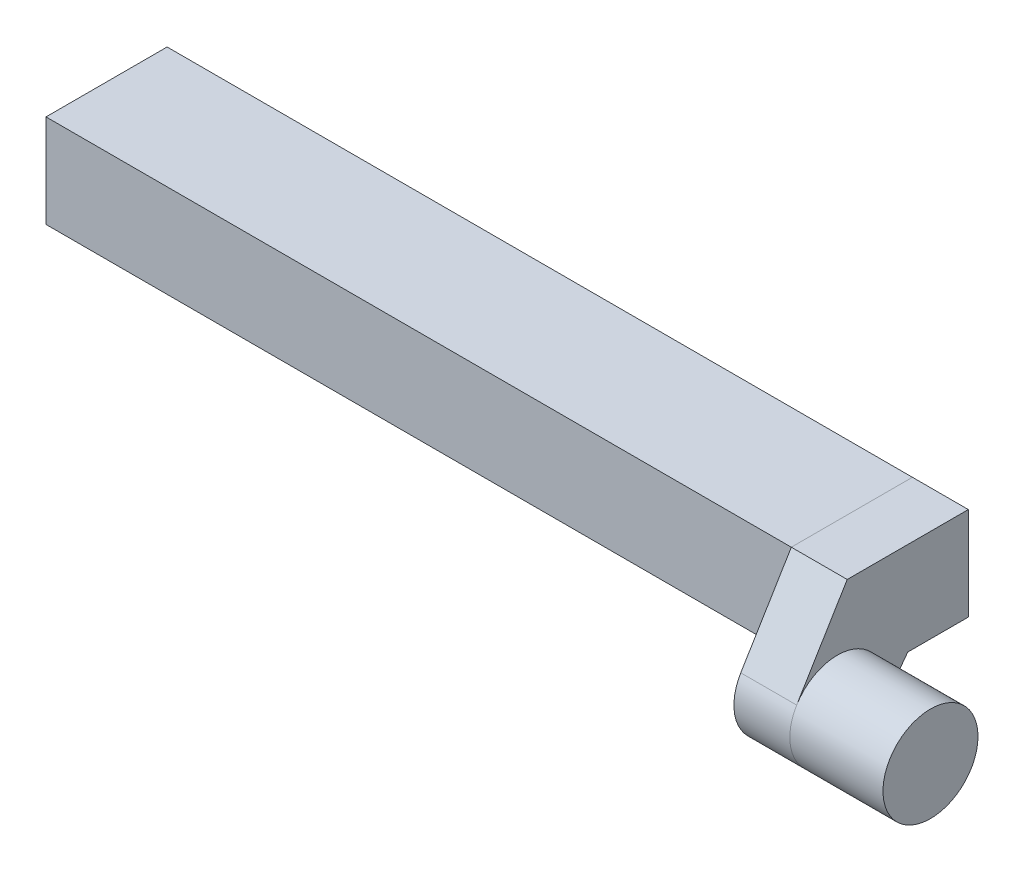
from build123d import *

# Parameters (mm, degrees)
SKETCH2_W           = 6.5
SKETCH2_H           = 5
SKETCH2_W_2         = 4.1
SKETCH2_H_2         = 4.1
BOSS_EXTRUDE1_DEPTH = 10
BOSS_EXTRUDE2_START = 15
SKETCH2_2_W         = 6.5
SKETCH2_2_H         = 5
BOSS_EXTRUDE2_DEPTH = 25
BOSS_EXTRUDE3_DEPTH = 3
SKETCH6_R           = 2.55
BOSS_EXTRUDE4_DEPTH = 5
BOSS_EXTRUDE5_START = 10
SKETCH2_4_W         = 6.5
SKETCH2_4_H         = 5
SKETCH2_4_W_2       = 4.1
SKETCH2_4_H_2       = 4.1
BOSS_EXTRUDE5_DEPTH = 5


with BuildPart() as part:
    # Sketch2 → Boss-Extrude1 (new body)
    with BuildSketch(Plane(origin=(0, 0, 0), x_dir=(0, 0, -1), z_dir=(1, 0, 0))):
        Rectangle(SKETCH2_W, SKETCH2_H)
        Rectangle(SKETCH2_W_2, SKETCH2_H_2, mode=Mode.SUBTRACT)
    extrude(amount=BOSS_EXTRUDE1_DEPTH)



with BuildPart() as body_2:
    # Sketch2<2> → Boss-Extrude2 (new body)
    with BuildSketch(Plane(origin=(0, 0, 0), x_dir=(0, 0, -1), z_dir=(1, 0, 0)).offset(BOSS_EXTRUDE2_START)):
        Rectangle(SKETCH2_2_W, SKETCH2_2_H)
    extrude(amount=BOSS_EXTRUDE2_DEPTH)


with BuildPart() as body_3:
    # Sketch5 → Boss-Extrude3 (new body)
    with BuildSketch(Plane(origin=(40, 0, 0), x_dir=(0, 0, -1), z_dir=(1, 0, 0))):
        with BuildLine():
            Line((-5.962330568, -1.982956835), (-3.25, 2.5))
            Line((-3.25, 2.5), (3.25, 2.5))
            Line((3.25, 2.5), (3.25, -2.5))
            Line((3.25, -2.5), (0, -2.5))
            Line((0, -2.5), (-1.736733495, -4.827839604))
            ThreePointArc((-1.736733495, -4.827839604), (-5.20469314, -5.418263169), (-5.962330568, -1.982956835))
        make_face()
    extrude(amount=BOSS_EXTRUDE3_DEPTH)


with BuildPart() as body_4:
    # Sketch6 → Boss-Extrude4 (new body)
    with BuildSketch(Plane(origin=(43, 0, 0), x_dir=(0, 0, -1), z_dir=(1, 0, 0))):
        with Locations((-3.780581608, -3.302983909)):
            Circle(SKETCH6_R)
    extrude(amount=BOSS_EXTRUDE4_DEPTH)


with BuildPart() as part_1:
    add(part.part)

    add(body_2.part)  # Boss-Extrude5 merges body 2
    # Sketch2<4> → Boss-Extrude5 (add)
    with BuildSketch(Plane(origin=(0, 0, 0), x_dir=(0, 0, -1), z_dir=(1, 0, 0)).offset(BOSS_EXTRUDE5_START)):
        Rectangle(SKETCH2_4_W, SKETCH2_4_H)
        Rectangle(SKETCH2_4_W_2, SKETCH2_4_H_2, mode=Mode.SUBTRACT)
    extrude(amount=BOSS_EXTRUDE5_DEPTH)


solid = Compound([body_3.part, body_4.part, part_1.part])
